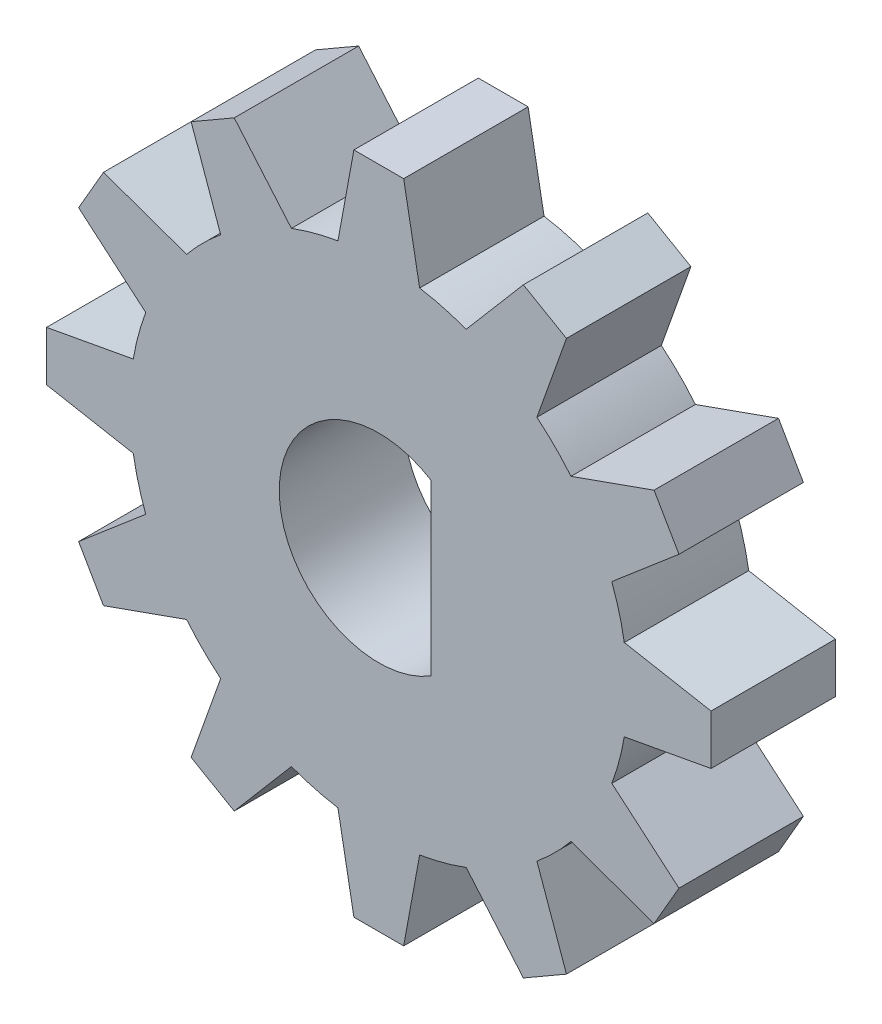
from build123d import *

# Parameters (mm, degrees)
SKETCH1_R           = 10
BOSS_EXTRUDE1_DEPTH = 5
BOSS_EXTRUDE2_DEPTH = 5
CIRPATTERN1_COUNT   = 12
CUT_EXTRUDE1_DEPTH  = 7


with BuildPart() as part:
    # Sketch1 → Boss-Extrude1 (new body)
    with BuildSketch(Plane.XY):
        Circle(SKETCH1_R)
    extrude(amount=BOSS_EXTRUDE1_DEPTH)

    # Sketch3 → Boss-Extrude2 (add)
    with BuildSketch(Plane.XY):
        Polygon((-1, 13.35), (1, 13.35), (1.8, 9), (-1.8, 9), align=None)
    boss_extrude2 = extrude(amount=BOSS_EXTRUDE2_DEPTH)

    # CirPattern1: Boss-Extrude2 ×12 about axis
    cirpattern1_axis = Axis((0, 0, 0), (0, 0, 1))
    for i in range(1, CIRPATTERN1_COUNT):
        add(boss_extrude2.rotate(cirpattern1_axis, i * 360 / CIRPATTERN1_COUNT))

    # Sketch4 → Cut-Extrude1 (cut)
    with BuildSketch(Plane.XY):
        with BuildLine():
            Line((2.1, 3.404408906), (2.1, -3.404408906))
            ThreePointArc((2.1, -3.404408906), (-4, 0), (2.1, 3.404408906))
        make_face()
    extrude(amount=CUT_EXTRUDE1_DEPTH, mode=Mode.SUBTRACT)


solid = part.part
